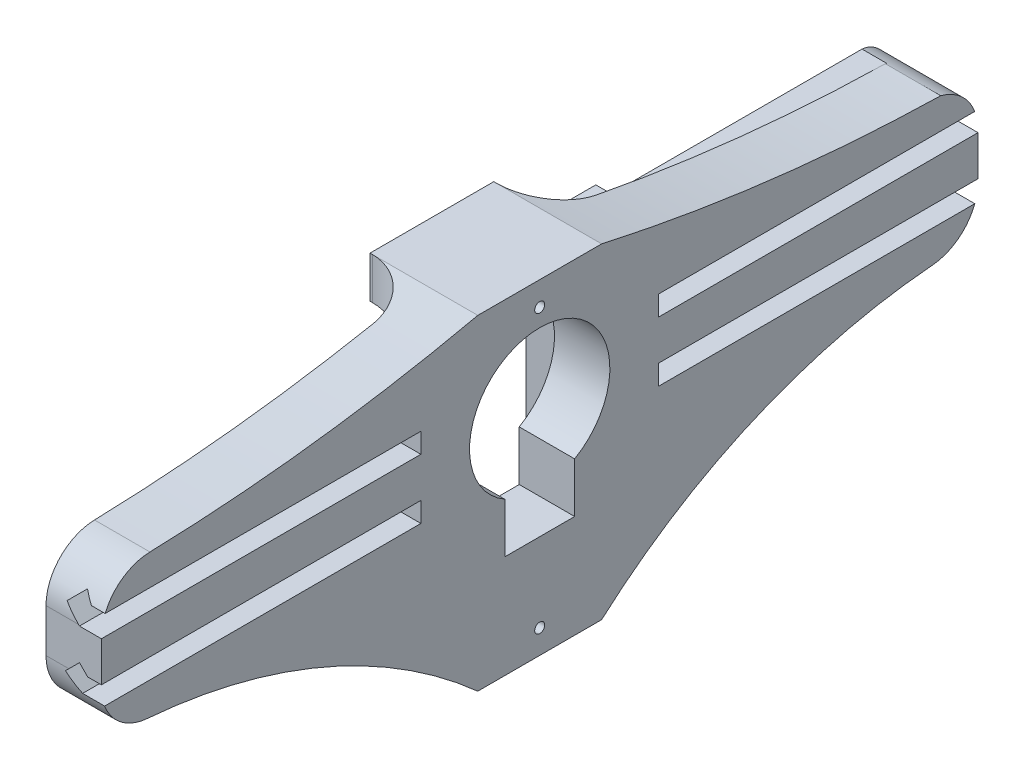
from build123d import *

# Parameters (mm, degrees)
SKETCH1_R               = 2
BOSS_EXTRUDE3_DEPTH     = 7
SKETCH3_R               = 1.0000000000000002
SKETCH3_R_2             = 0.9999999999999998
SKETCH3_R_3             = 0.9999999999999996
SKETCH3_R_4             = 0.9999999999999993
CUT_EXTRUDE2_DEPTH      = 26.09227496303999
BOSS_EXTRUDE4_START     = -7
BOSS_EXTRUDE4_DEPTH     = 7
BOSS_EXTRUDE5_START     = -30
BOSS_EXTRUDE5_DEPTH     = 30
FILLET2_R               = 1.5
CUT_EXTRUDE5_DEPTH      = 42.36510924463761
BOSS_EXTRUDE6_DEPTH     = 10.5
MOVE_START              = -28.7
MOVE_FACE1_DEPTH        = 5.7
DELETEFACE1_START       = 23.7
DELETEFACE1_OUTLINE_W   = 10.499999999999998
DELETEFACE1_OUTLINE_H   = 35.699999999999996
DELETEFACE1_DEPTH       = 15.7
SKETCH11_OUTSIDE_W      = 51.876
SKETCH11_OUTSIDE_H      = 42.462
CUT_EXTRUDE6_DEPTH      = 46.16926949380307
SERVO_START             = -12.760864102
SERVO_MICRO_OUTLINE_W   = 22.6
SERVO_MICRO_OUTLINE_H   = 12.399999999999999
SERVO_MICRO_DEPTH       = 22.3
SERVO_START_2           = 9.539135898
SERVO_MICRO_2_DEPTH     = 4.3
SERVO_START_3           = 2.889135898
SERVO_MICRO_3_DEPTH     = 2.4
SERVO_START_4           = 13.839135898
SERVO_MICRO_4_OUTLINE_R = 2.5
SERVO_MICRO_4_DEPTH     = 3.3
SERVO_START_5           = -25.667487826
SERVO_MICRO_5_OUTLINE_R = 0.6
SERVO_MICRO_5_DEPTH     = 2.3
SERVO_MICRO_6_OUTLINE_R = 0.6
SERVO_MICRO_6_DEPTH     = 2.3
SERVO_MICRO_7_OUTLINE_R = 0.6
SERVO_MICRO_7_DEPTH     = 2.3
BODY_MOVE_COPY1_ANGLE   = 90
SKETCH13_R              = 0.5000000000000009
BOSS_EXTRUDE7_DEPTH     = 5.55
SKETCH13_3_R            = 0.5000000000000009
BOSS_EXTRUDE8_DEPTH     = 10.8
CUT_EXTRUDE7_DEPTH      = 32
BOSS_EXTRUDE9_DEPTH     = 5.55
CUT_EXTRUDE8_DEPTH      = 72.0125468998838
BOSS_EXTRUDE10_DEPTH    = 5.55
FILLET4_R               = 5
CUT_EXTRUDE10_DEPTH     = 72.01254695034633
FILLET8_START           = 12.13472734
FILLET8_DEPTH           = 2.98662
FILLET8_START_2         = -12.463268044
FILLET8_2_DEPTH         = 0.328540704
FILLET8_START_3         = -16.295273118
FILLET8_3_DEPTH         = 3.832005074
FILLET8_START_4         = 15.12134734
FILLET8_4_DEPTH         = 1.18338
FILLET8_START_5         = -7.24411042
FILLET8_5_DEPTH         = 25.39411042
FILLET9_R               = 1
CUT_EXTRUDE11_REACH     = 67.729
SKETCH20_W              = 27.71545594337198
SKETCH20_H              = 25.17831686014588


with BuildPart() as part:
    # Sketch1 → Boss-Extrude3 (new body)
    with BuildSketch(Plane.XY):
        with BuildLine():
            Line((5.606455718863049, 13.824363162033857), (-15.462379801128069, 15.791841653866829))
            Line((-15.462379801128069, 15.791841653866829), (-15.46237980112806, -15.791841653866806))
            Line((-15.46237980112806, -15.791841653866806), (5.606455718863063, -13.824363162033817))
            ThreePointArc((5.606455718863063, -13.824363162033817), (18.200000000000003, 2.613e-14), (5.606455718863049, 13.824363162033857))
        make_face()
        Circle(SKETCH1_R, mode=Mode.SUBTRACT)
    extrude(amount=BOSS_EXTRUDE3_DEPTH)

    # Sketch3 → Cut-Extrude2 (cut, through all)
    with BuildSketch(Plane.XY.offset(7)):
        with Locations((-4.5, 0)):
            Circle(SKETCH3_R)
        with Locations((-8.499999999999998, 0)):
            Circle(SKETCH3_R_2)
        with Locations(Location((4.5, -1.73e-15, 0), (0, 0, 180))):
            Circle(SKETCH3_R_3)
        with Locations(Location((8.499999999999998, -1.73e-15, 0), (0, 0, 180))):
            Circle(SKETCH3_R_4)
    extrude(amount=-CUT_EXTRUDE2_DEPTH, mode=Mode.SUBTRACT)

    # Sketch6 → Boss-Extrude4 (add)
    with BuildSketch(Plane.XY.offset(7).offset(BOSS_EXTRUDE4_START)):
        with BuildLine():
            Line((12.20372638619735, 13.208287910486863), (5.606455718863047, 13.824363162033858))
            ThreePointArc((5.606455718863047, 13.82436316203386), (18.2, 2.598e-14), (5.606455718863056, -13.824363162033816))
            Line((5.606455718863056, -13.824363162033816), (12.203726386197348, -13.208287910486817))
            ThreePointArc((12.203726386197348, -13.208287910486817), (19.699999999999996, 2.132e-14), (12.20372638619735, 13.20828791048686))
        make_face()
    extrude(amount=BOSS_EXTRUDE4_DEPTH)

    # Sketch6<3> → Boss-Extrude5 (add)
    with BuildSketch(Plane.XY.offset(7).offset(BOSS_EXTRUDE5_START)):
        with BuildLine():
            Line((23.700000000000006, 12.13472734042489), (12.20372638619735, 13.208287910486863))
            ThreePointArc((12.20372638619735, 13.20828791048686), (19.699999999999996, 2.132e-14), (12.203726386197348, -13.208287910486817))
            Line((12.203726386197348, -13.208287910486817), (23.700000000000003, -12.134727340424835))
            Line((23.700000000000003, -12.134727340424835), (23.700000000000006, 12.134727340424892))
        make_face()
    extrude(amount=BOSS_EXTRUDE5_DEPTH)

    # Fillet2
    fillet2_edges = [part.edges().sort_by_distance(p)[0] for p in [
        (12.20372638619735, -13.208287910486817, -11.5),
        (12.20372638619735, 13.208287910486861, -11.5),
    ]]
    fillet(fillet2_edges, radius=FILLET2_R)

    # Sketch8 → Cut-Extrude5 (cut, through all)
    with BuildSketch(Plane.XY.offset(7)):
        with BuildLine():
            Line((-15.462379801128069, 15.791841653866829), (-15.46237980112806, -15.791841653866808))
            Line((-15.46237980112806, -15.791841653866806), (1.328273056892355, -14.223874201150027))
            ThreePointArc((1.3282730568923518, -14.22387420115002), (-14.285758873920813, 0), (1.3282730568923529, 14.22387420115002))
            Line((1.3282730568923604, 14.223874201150062), (-15.462379801128069, 15.791841653866829))
        make_face()
    extrude(amount=-CUT_EXTRUDE5_DEPTH, mode=Mode.SUBTRACT)

    # Sketch10 → Boss-Extrude6 (add)
    with BuildSketch(Plane.ZX.offset(1.6347273404248903)):
        Polygon((7, 23.700000000000003), (7, 39.40000000018666), (-28.700000000000003, 39.40000000018665), (-28.700000000000014, 23.700000000000003), align=None)
    extrude(amount=BOSS_EXTRUDE6_DEPTH)

    # Move Face1: read off the stored shape, not the designer's step
    # Move Face1 outline → Move Face1 (add)
    with BuildSketch(Plane.XY.offset(MOVE_START)):
        with BuildLine():
            Line((17.033263706, -12.757289525), (23.7, -12.13472734))
            Line((23.7, -12.13472734), (23.7, 12.13472734))
            Line((23.7, 12.13472734), (17.033263706, 12.757289525))
            ThreePointArc((17.033263706, 12.757289525), (15.554272674, 11.938827155), (15.776353621, 10.263125757))
            ThreePointArc((15.776353621, 10.263125757), (19.7, 0), (15.776353621, -10.263125757))
            ThreePointArc((15.776353621, -10.263125757), (15.554272674, -11.938827155), (17.033263706, -12.757289525))
        make_face()
    extrude(amount=MOVE_FACE1_DEPTH)

    # DeleteFace1: read off the stored shape, not the designer's step
    # DeleteFace1 outline → DeleteFace1 (cut)
    with BuildSketch(Plane.YZ.offset(DELETEFACE1_START)):
        with Locations((6.884727339999999, -10.849999999999998)):
            Rectangle(DELETEFACE1_OUTLINE_W, DELETEFACE1_OUTLINE_H)
    extrude(amount=DELETEFACE1_DEPTH, mode=Mode.SUBTRACT)

    # Sketch11 outside → Cut-Extrude6 (cut, through all)
    with BuildSketch(Plane.XY.offset(7)):
        with Locations((4.706999999999997, 0)):
            Rectangle(SKETCH11_OUTSIDE_W, SKETCH11_OUTSIDE_H)
        with BuildLine():
            Line((23.700000000000003, 12.134727340424888), (-1.43e-15, 12.134727340424885))
            ThreePointArc((-1.43e-15, 12.134727340424885), (-12.134727340424885, 1.49e-15), (0, -12.134727340424885))
            Line((0, -12.134727340424885), (23.700000000000006, -12.134727340424835))
            Line((23.700000000000006, -12.134727340424835), (23.700000000000003, 12.134727340424888))
        make_face(mode=Mode.SUBTRACT)
    extrude(amount=-CUT_EXTRUDE6_DEPTH, mode=Mode.SUBTRACT)

    # Sketch13 → Boss-Extrude7 (add)
    # profile 1 of 3: a face of its own
    with BuildSketch(Plane(origin=(23.700000000000003, -3.39e-15, 0), x_dir=(0, 0, -1), z_dir=(1, -1.4e-16, 0))):
        Polygon((-8.999999999999998, -16.295272659575108), (-9.000000000000002, -12.134727340424831), (-7, -12.134727340424831), (-6.999999999999999, 12.134727340424892), (-9.000000000000002, 12.134727340424888), (-9.000000000000002, 16.30472734042489), (-21.4, 16.30472734042489), (-21.399999999999995, 12.134727340424888), (-59.100000000000016, 12.134727340424885), (-59.100000000000016, -12.134727340424831), (-21.399999999999995, -12.134727340424831), (-21.4, -16.295272659575108), align=None)
        with Locations(Location((-15.200000000000001, 13.904727340424891, 0), (0, 0, 90))):
            Circle(SKETCH13_R, mode=Mode.SUBTRACT)
        with Locations(Location((-15.200000000000001, -13.895272659575111, 0), (0, 0, 90))):
            Circle(SKETCH13_R, mode=Mode.SUBTRACT)
        with BuildLine():
            ThreePointArc((-11.700000000000001, -0.9920668991734916), (-15.199999999999998, 12.13472734042489), (-18.700000000000003, -0.9920668991734924))
            Line((-18.700000000000003, -0.9920668991734924), (-18.700000000000003, -5.9920668991734924))
            Line((-18.700000000000003, -5.9920668991734924), (-11.700000000000003, -5.992066899173492))
            Line((-11.700000000000003, -5.992066899173492), (-11.700000000000001, -0.9920668991734916))
        make_face(mode=Mode.SUBTRACT)
    # profile 2 of 3: a face of its own
    with BuildSketch(Plane(origin=(23.700000000000003, -3.39e-15, 0), x_dir=(0, 0, -1), z_dir=(1, -1.4e-16, 0))):
        Polygon((-21.399999999999995, 12.134727340424888), (-21.4, 16.30472734042489), (-9.000000000000002, 16.30472734042489), (-9.000000000000002, 12.134727340424888), align=None)
        with Locations(Location((-15.200000000000001, 13.904727340424891, 0), (0, 0, 90))):
            Circle(SKETCH13_R, mode=Mode.SUBTRACT)
    # profile 3 of 3: a face of its own
    with BuildSketch(Plane(origin=(23.700000000000003, -3.39e-15, 0), x_dir=(0, 0, -1), z_dir=(1, -1.4e-16, 0))):
        Polygon((-21.399999999999995, -12.134727340424831), (-9.000000000000002, -12.134727340424831), (-8.999999999999998, -16.295272659575108), (-21.4, -16.295272659575108), align=None)
        with Locations(Location((-15.200000000000001, -13.895272659575111, 0), (0, 0, 90))):
            Circle(SKETCH13_R, mode=Mode.SUBTRACT)
    extrude(amount=-BOSS_EXTRUDE7_DEPTH)

    # Sketch13<3> → Boss-Extrude8 (add)
    # profile 1 of 2: a face of its own
    with BuildSketch(Plane(origin=(23.700000000000003, -3.39e-15, 0), x_dir=(0, 0, -1), z_dir=(1, -1.4e-16, 0))):
        Polygon((-21.399999999999995, 12.134727340424888), (-21.4, 16.30472734042489), (-9.000000000000002, 16.30472734042489), (-9.000000000000002, 12.134727340424888), align=None)
        with Locations(Location((-15.200000000000001, 13.904727340424891, 0), (0, 0, 90))):
            Circle(SKETCH13_3_R, mode=Mode.SUBTRACT)
    # profile 2 of 2: a face of its own
    with BuildSketch(Plane(origin=(23.700000000000003, -3.39e-15, 0), x_dir=(0, 0, -1), z_dir=(1, -1.4e-16, 0))):
        Polygon((-21.399999999999995, -12.134727340424831), (-9.000000000000002, -12.134727340424831), (-8.999999999999998, -16.295272659575108), (-21.4, -16.295272659575108), align=None)
        with Locations(Location((-15.200000000000001, -13.895272659575111, 0), (0, 0, 90))):
            Circle(SKETCH13_3_R, mode=Mode.SUBTRACT)
    extrude(amount=-BOSS_EXTRUDE8_DEPTH)

    # Sketch15 → Cut-Extrude7 (cut)
    with BuildSketch(Plane(origin=(1.903e-14, 0, -28.70000000000003), x_dir=(-1, 0, -6.6e-16), z_dir=(6.6e-16, 0, -1))):
        Polygon((-22.328427124746177, 3.104727340424887), (-23.699999999999985, 3.104727340424887), (-23.699999999999985, 1.1047273404248876), (-21.499999999999986, 1.1047273404248876), (-20.08578643762689, 2.5189409027979854), (-21.49999999999999, 3.9331544651710773), align=None)
        Polygon((-22.328427124746177, 9.104727340424887), (-23.699999999999985, 9.104727340424887), (-23.699999999999985, 7.104727340424887), (-21.499999999999986, 7.104727340424887), (-20.08578643762689, 8.518940902797986), (-21.49999999999999, 9.933154465171077), align=None)
    cut_extrude7 = extrude(amount=-CUT_EXTRUDE7_DEPTH, mode=Mode.SUBTRACT)

    # Mirror1: Cut-Extrude7 across plane
    add(cut_extrude7.mirror(Plane(origin=(0, 0, 15.200000000000001), x_dir=(1, 0, 0), z_dir=(0, 0, -1))), mode=Mode.SUBTRACT)

    # Sketch16 → Boss-Extrude9 (add)
    with BuildSketch(Plane(origin=(23.700000000000003, -3.39e-15, 0), x_dir=(0, 0, -1), z_dir=(1, -1.4e-16, 0))):
        with BuildLine():
            Line((-21.399999999999995, 12.134727340424888), (-21.4, 16.30472734042489))
            ThreePointArc((-21.4, 16.30472734042489), (-40.135039546574305, 13.18039662240372), (-59.100000000000016, 12.134727340424885))
            Line((-59.100000000000016, 12.134727340424885), (-21.399999999999995, 12.134727340424888))
        make_face()
        with BuildLine():
            Line((-9.000000000000002, 16.30472734042489), (-9.000000000000002, 12.13472734042489))
            Line((-9.000000000000002, 12.13472734042489), (28.700000000000014, 12.134727340424892))
            ThreePointArc((28.700000000000014, 12.134727340424892), (9.735039546574328, 13.180396622403777), (-9.000000000000002, 16.30472734042489))
        make_face()
    extrude(amount=-BOSS_EXTRUDE9_DEPTH)

    # Sketch18 → Cut-Extrude8 (cut, through all)
    with BuildSketch(Plane(origin=(23.700000000000003, -3.39e-15, 0), x_dir=(0, 0, -1), z_dir=(1, -1.4e-16, 0))):
        with BuildLine():
            Line((-59.100000000000016, -12.134727340424831), (-26.661429094135563, -12.134727340424831))
            ThreePointArc((-26.661429094135563, -12.134727340424838), (-42.096369157624615, -4.537893974213425), (-59.100000000000016, -1.9252726595751))
            Line((-59.100000000000016, -1.9252726595751037), (-59.100000000000016, -12.134727340424831))
        make_face()
        with BuildLine():
            Line((-3.7385709058644423, -12.134727340424831), (28.700000000000003, -12.134727340424831))
            Line((28.700000000000003, -12.134727340424831), (28.700000000000003, -1.9252726595751037))
            ThreePointArc((28.700000000000003, -1.9252726595751), (11.69636915762461, -4.537893974213425), (-3.738570905864435, -12.134727340424838))
        make_face()
    extrude(amount=-CUT_EXTRUDE8_DEPTH, mode=Mode.SUBTRACT)

    # Sketch18<3> → Boss-Extrude10 (add)
    with BuildSketch(Plane(origin=(23.700000000000003, -3.39e-15, 0), x_dir=(0, 0, -1), z_dir=(1, -1.4e-16, 0))):
        with BuildLine():
            ThreePointArc((-26.661429094135563, -12.134727340424838), (-23.96906894889605, -14.137042924937433), (-21.4, -16.295272659575097))
            Line((-21.4, -16.295272659575108), (-21.4, -12.134727340424831))
            Line((-21.4, -12.134727340424831), (-26.66142909413556, -12.134727340424831))
        make_face()
        with BuildLine():
            ThreePointArc((-9, -16.295272659575097), (-6.430931051103947, -14.137042924937433), (-3.738570905864435, -12.134727340424838))
            Line((-3.7385709058644423, -12.134727340424831), (-9.000000000000005, -12.134727340424831))
            Line((-9.000000000000005, -12.134727340424831), (-9.000000000000005, -16.295272659575108))
        make_face()
    extrude(amount=-BOSS_EXTRUDE10_DEPTH)

    # Fillet4
    fillet4_edges = [part.edges().sort_by_distance(p)[0] for p in [
        (21.63952842596371, -1.9252726595751048, -28.700000000000003),
        (20.925, -1.925272659575101, 59.10000000000002),
        (20.925000000000004, 12.134727340424881, 59.100000000000016),
    ]]
    fillet(fillet4_edges, radius=FILLET4_R)

    # Sketch19 → Cut-Extrude10 (cut, through all)
    with BuildSketch(Plane(origin=(23.700000000000003, -3.39e-15, 0), x_dir=(0, 0, -1), z_dir=(1, -1.4e-16, 0))):
        with BuildLine():
            Line((24.105591483628846, 12.321380196120076), (30.19974331893468, 12.321380196120076))
            Line((30.19974331893468, 12.321380196120076), (30.19974331893468, 7.512752922909521))
            Line((30.19974331893468, 7.512752922909521), (28.687547870024137, 7.690513778051795))
            ThreePointArc((28.687547870024137, 7.690513778051795), (28.58393863914358, 8.408905582685197), (28.37741082226619, 9.10472734042489))
            ThreePointArc((28.37741082226619, 9.10472734042489), (26.70764725474025, 11.33211091295099), (24.105591483628846, 12.321380196120076))
        make_face()
    extrude(amount=-CUT_EXTRUDE10_DEPTH, mode=Mode.SUBTRACT)

    # Fillet8: read off the stored shape, not the designer's step
    # Fillet8 outline → Fillet8 (add)
    with BuildSketch(Plane(origin=(0, 0, 0), x_dir=(1, 0, 0), z_dir=(0, 1, 0)).offset(FILLET8_START)):
        with BuildLine():
            Line((13.15, -9), (18.15, -9))
            Line((18.15, -9), (18.15, -4))
            ThreePointArc((18.15, -4), (16.685533906, -7.535533906), (13.15, -9))
        make_face()
        with BuildLine():
            ThreePointArc((13.15, -21.4), (16.685533906, -22.864466094), (18.15, -26.4))
            Line((18.15, -26.4), (18.15, -21.4))
            Line((18.15, -21.4), (13.15, -21.4))
        make_face()
    extrude(amount=FILLET8_DEPTH)

    # Fillet8 2 outline → Fillet8 2 (add)
    with BuildSketch(Plane(origin=(0, 0, 0), x_dir=(1, 0, 0), z_dir=(0, 1, 0)).offset(FILLET8_START_2)):
        with BuildLine():
            Line((13.15, -9), (18.15, -9))
            Line((18.15, -9), (18.15, -4))
            ThreePointArc((18.15, -4), (16.685533906, -7.535533906), (13.15, -9))
        make_face()
        with BuildLine():
            ThreePointArc((13.15, -21.4), (16.685533906, -22.864466094), (18.15, -26.4))
            Line((18.15, -26.4), (18.15, -21.4))
            Line((18.15, -21.4), (13.15, -21.4))
        make_face()
    extrude(amount=FILLET8_2_DEPTH)

    # Fillet8 3 outline → Fillet8 3 (add)
    with BuildSketch(Plane(origin=(0, 0, 0), x_dir=(1, 0, 0), z_dir=(0, 1, 0)).offset(FILLET8_START_3)):
        with BuildLine():
            ThreePointArc((13.15, -21.4), (16.685533906, -22.864466094), (18.15, -26.4))
            Line((18.15, -26.4), (18.15, -21.4))
            Line((18.15, -21.4), (13.15, -21.4))
        make_face()
        with BuildLine():
            ThreePointArc((18.15, -4), (16.685533906, -7.535533906), (13.15, -9))
            Line((13.15, -9), (18.15, -9))
            Line((18.15, -9), (18.15, -4))
        make_face()
    extrude(amount=FILLET8_3_DEPTH)

    # Fillet8 4 outline → Fillet8 4 (add)
    with BuildSketch(Plane(origin=(0, 0, 0), x_dir=(1, 0, 0), z_dir=(0, 1, 0)).offset(FILLET8_START_4)):
        with BuildLine():
            ThreePointArc((13.15, -21.4), (16.685533906, -22.864466094), (18.15, -26.4))
            Line((18.15, -26.4), (18.15, -21.4))
            Line((18.15, -21.4), (13.15, -21.4))
        make_face()
        with BuildLine():
            ThreePointArc((18.15, -4), (16.685533906, -7.535533906), (13.15, -9))
            Line((13.15, -9), (18.15, -9))
            Line((18.15, -9), (18.15, -4))
        make_face()
    extrude(amount=FILLET8_4_DEPTH)

    # Fillet8 5 outline → Fillet8 5 (cut)
    with BuildSketch(Plane.YZ.offset(FILLET8_START_5)):
        with BuildLine():
            ThreePointArc((-12.31848008, 4), (-14.236321993, 6.556116122), (-16.295272761, 9.000000114))
            Line((-16.295272761, 9.000000114), (-16.295273118, 4))
            Line((-16.295273118, 4), (-12.31848008, 4))
        make_face()
        with BuildLine():
            Line((-16.295273118, 26.4), (-16.295272761, 21.399999886))
            ThreePointArc((-16.295272761, 21.399999886), (-14.236321993, 23.843883878), (-12.31848008, 26.4))
            Line((-12.31848008, 26.4), (-16.295273118, 26.4))
        make_face()
        with BuildLine():
            Line((16.30472734, 26.4), (15.262410605, 26.4))
            ThreePointArc((15.262410605, 26.4), (15.765062943, 23.896142171), (16.30472734, 21.4))
            Line((16.30472734, 21.4), (16.30472734, 26.4))
        make_face()
        with BuildLine():
            Line((16.30472734, 4), (16.30472734, 9))
            ThreePointArc((16.30472734, 9), (15.765062943, 6.503857829), (15.262410605, 4))
            Line((15.262410605, 4), (16.30472734, 4))
        make_face()
    extrude(amount=FILLET8_5_DEPTH, mode=Mode.SUBTRACT)

    # Fillet9
    fillet9_edges = [part.edges().sort_by_distance(p)[0] for p in [
        (18.150000000000002, 2.76e-14, 7),
    ]]
    fillet(fillet9_edges, radius=FILLET9_R)

    # Sketch20 → Cut-Extrude11 (cut, up to next)
    with BuildSketch(Plane(origin=(0, 0, 0), x_dir=(-1, 0, 0), z_dir=(0, 0, -1)), mode=Mode.PRIVATE) as cut_extrude11_sk1:
        with Locations((-0.26171750586786313, -0.4544310896480539)):
            Rectangle(SKETCH20_W, SKETCH20_H)
    cut_extrude11_tool1 = extrude(cut_extrude11_sk1.sketch, amount=-CUT_EXTRUDE11_REACH, mode=Mode.PRIVATE) & part.part
    add(cut_extrude11_tool1.solids().sort_by_distance((0.261718, -0.454431, 0))[0], mode=Mode.SUBTRACT)


with BuildPart() as body_2:
    # Servo Micro: read off the stored shape, not the designer's step
    # Servo Micro outline → Servo Micro (new body)
    with BuildSketch(Plane(origin=(0, 0, 0), x_dir=(1, 0, 0), z_dir=(0, 1, 0)).offset(SERVO_START)):
        with Locations((-12.067487826, -26.388081974)):
            Rectangle(SERVO_MICRO_OUTLINE_W, SERVO_MICRO_OUTLINE_H)
    extrude(amount=SERVO_MICRO_DEPTH)

    # Servo Micro 2 outline → Servo Micro 2 (add)
    with BuildSketch(Plane(origin=(0, 0, 0), x_dir=(1, 0, 0), z_dir=(0, 1, 0)).offset(SERVO_START_2)):
        with BuildLine():
            ThreePointArc((-11.10082116, -25.109193568), (-23.367487826, -26.388081974), (-11.10082116, -27.666970381))
            ThreePointArc((-11.10082116, -27.666970381), (-9.567487826, -26.388081975), (-11.10082116, -25.109193568))
        make_face()
    extrude(amount=SERVO_MICRO_2_DEPTH)

    # Servo Micro 3 outline → Servo Micro 3 (add)
    with BuildSketch(Plane(origin=(0, 0, 0), x_dir=(1, 0, 0), z_dir=(0, 1, 0)).offset(SERVO_START_3)):
        with BuildLine():
            Line((2.667676828, -25.838081974), (4.232512174, -25.838081974))
            Line((4.232512174, -25.838081974), (4.232512174, -20.188081974))
            Line((4.232512174, -20.188081974), (-0.767487826, -20.188081974))
            Line((-0.767487826, -20.188081974), (-0.767487826, -32.588081974))
            Line((-0.767487826, -32.588081974), (4.232512174, -32.588081974))
            Line((4.232512174, -32.588081974), (4.232512174, -26.938081974))
            Line((4.232512174, -26.938081974), (2.667676828, -26.938081974))
            ThreePointArc((2.667676828, -26.938081974), (0.832512174, -26.388081974), (2.667676828, -25.838081974))
        make_face()
        with BuildLine():
            Line((-23.367487826, -32.588081974), (-23.367487826, -20.188081974))
            Line((-23.367487826, -20.188081974), (-28.367487826, -20.188081974))
            Line((-28.367487826, -20.188081974), (-28.367487826, -25.838081974))
            Line((-28.367487826, -25.838081974), (-26.802652481, -25.838081974))
            ThreePointArc((-26.802652481, -25.838081974), (-24.967487826, -26.388081974), (-26.802652481, -26.938081974))
            Line((-26.802652481, -26.938081974), (-28.367487826, -26.938081974))
            Line((-28.367487826, -26.938081974), (-28.367487826, -32.588081974))
            Line((-28.367487826, -32.588081974), (-23.367487826, -32.588081974))
        make_face()
    extrude(amount=SERVO_MICRO_3_DEPTH)

    # Servo Micro 4 outline → Servo Micro 4 (add)
    with BuildSketch(Plane(origin=(0, 0, 0), x_dir=(1, 0, 0), z_dir=(0, 1, 0)).offset(SERVO_START_4)):
        with Locations((-17.167487826, -26.388081974)):
            Circle(SERVO_MICRO_4_OUTLINE_R)
    extrude(amount=SERVO_MICRO_4_DEPTH)


with BuildPart() as body_3:
    # Servo Micro 5 outline → Servo Micro 5 (new body)
    with BuildSketch(Plane.YZ.offset(SERVO_START_5)):
        with Locations((-8.260864102, 25.188081974)):
            Circle(SERVO_MICRO_5_OUTLINE_R)
    extrude(amount=SERVO_MICRO_5_DEPTH)


with BuildPart() as body_4:
    # Servo Micro 6 outline → Servo Micro 6 (new body)
    with BuildSketch(Plane.YZ.offset(SERVO_START_5)):
        with Locations((-8.260864102, 27.588081974)):
            Circle(SERVO_MICRO_6_OUTLINE_R)
    extrude(amount=SERVO_MICRO_6_DEPTH)


with BuildPart() as body_5:
    # Servo Micro 7 outline → Servo Micro 7 (new body)
    with BuildSketch(Plane.YZ.offset(SERVO_START_5)):
        with Locations((-8.260864102, 26.388081974)):
            Circle(SERVO_MICRO_7_OUTLINE_R)
    extrude(amount=SERVO_MICRO_7_DEPTH)


with BuildPart() as body_2_1:
    # Body-Move/Copy1: read off the stored shape, not the designer's step
    # Body-Move/Copy1: moved
    add(body_2.part.moved(Location((12.0627605, 7.6108641, -11.188082))).rotate(Axis((0, 0, 0), (0, 0, -1)), BODY_MOVE_COPY1_ANGLE))


solid = part.part
